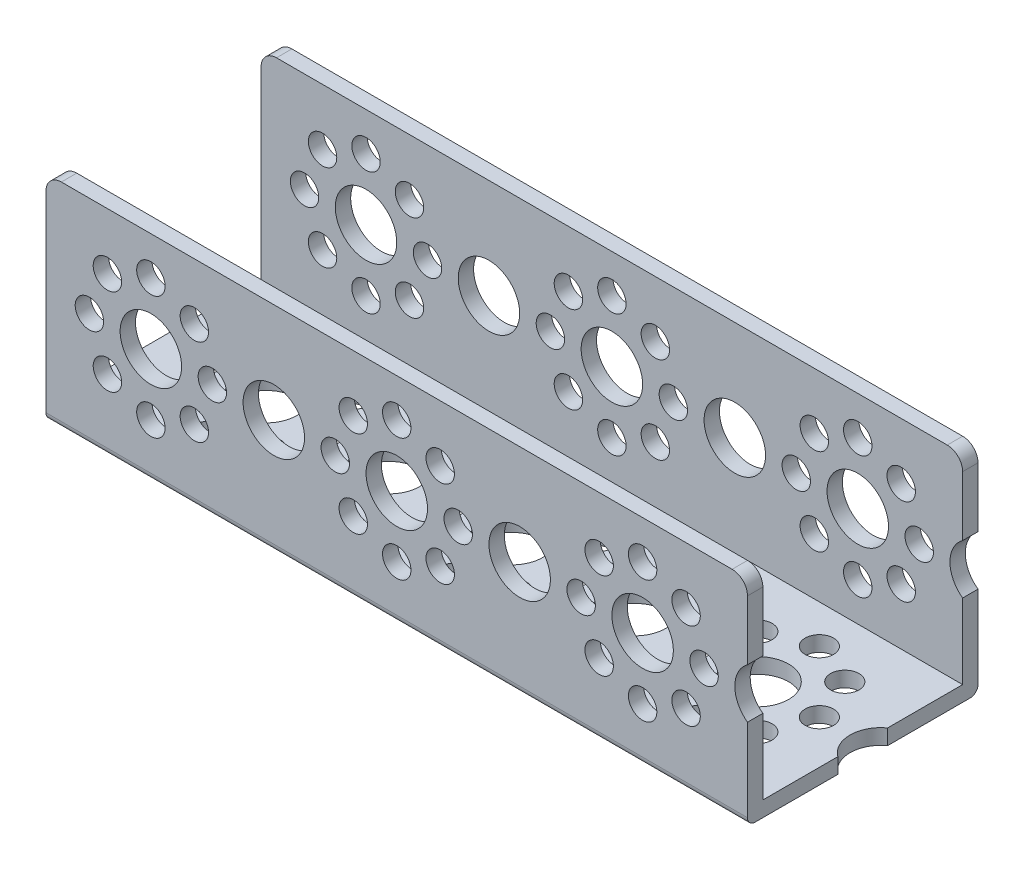
from build123d import *

# Parameters (mm, degrees)
EXTRUDE_2_DEPTH           = 91.3
HOLES_UP_R                = 4
HOLES_UP_R_2              = 1.85
CUT_EXTRUDE_1_DEPTH       = 15
CUT_EXTRUDE_START         = -15
CUT_EXTRUDE_2_OUTLINE_R   = 4
CUT_EXTRUDE_2_OUTLINE_R_2 = 1.85
CUT_EXTRUDE_2_DEPTH       = 30
FILLET_1_R                = 1
FILLET_2_R                = 2


with BuildPart() as part:
    # C Channel → 凸台-拉伸2 (new body)
    with BuildSketch(Plane.ZY.offset(13.65)):
        Polygon((-13, 13), (-15, 13), (-15, -15), (15, -15), (15, 13), (13, 13), (13, -13), (-13, -13), align=None)
    extrude(amount=-EXTRUDE_2_DEPTH)

    # holes up → 切除-拉伸1 (cut)
    with BuildSketch(Plane(origin=(0, 0, 0), x_dir=(1, 0, 0), z_dir=(0, 1, 0))):
        with Locations(Location((16, 0, 0), (0, 0, 270))):
            Circle(HOLES_UP_R)
        with Locations(Location((48, 0, 0), (0, 0, 270))):
            Circle(HOLES_UP_R)
        with Locations((80, 0)):
            Circle(HOLES_UP_R)
        with Locations((112, 0)):
            Circle(HOLES_UP_R)
        with Locations((144, 0)):
            Circle(HOLES_UP_R)
        with Locations((176, 0)):
            Circle(HOLES_UP_R)
        with Locations((208, 0)):
            Circle(HOLES_UP_R)
        with Locations((240, 0)):
            Circle(HOLES_UP_R)
        with Locations((272, 0)):
            Circle(HOLES_UP_R)
        with Locations((304, 0)):
            Circle(HOLES_UP_R)
        with Locations((336, 0)):
            Circle(HOLES_UP_R)
        with Locations((368, 0)):
            Circle(HOLES_UP_R)
        with Locations((400, 0)):
            Circle(HOLES_UP_R)
        with Locations((432, 0)):
            Circle(HOLES_UP_R)
        with Locations((464, 0)):
            Circle(HOLES_UP_R)
        with Locations((496, 0)):
            Circle(HOLES_UP_R)
        with Locations((528, 0)):
            Circle(HOLES_UP_R)
        with Locations((560, 0)):
            Circle(HOLES_UP_R)
        with Locations((592, 0)):
            Circle(HOLES_UP_R)
        with Locations((624, 0)):
            Circle(HOLES_UP_R)
        with Locations(Location((0, 0, 0), (0, 0, 270))):
            Circle(HOLES_UP_R)
        with Locations(Location((0, 8, 0), (0, 0, 270))):
            Circle(HOLES_UP_R_2)
        with Locations(Location((5.656854249, 5.656854249, 0), (0, 0, 270))):
            Circle(HOLES_UP_R_2)
        with Locations(Location((8, 0, 0), (0, 0, 270))):
            Circle(HOLES_UP_R_2)
        with Locations(Location((5.656854249, -5.656854249, 0), (0, 0, 270))):
            Circle(HOLES_UP_R_2)
        with Locations(Location((0, -8, 0), (0, 0, 270))):
            Circle(HOLES_UP_R_2)
        with Locations(Location((-5.656854249, -5.656854249, 0), (0, 0, 270))):
            Circle(HOLES_UP_R_2)
        with Locations(Location((-8, 0, 0), (0, 0, 270))):
            Circle(HOLES_UP_R_2)
        with Locations(Location((-5.656854249, 5.656854249, 0), (0, 0, 270))):
            Circle(HOLES_UP_R_2)
        with Locations(Location((32, 0, 0), (0, 0, 270))):
            Circle(HOLES_UP_R)
        with Locations(Location((32, 8, 0), (0, 0, 270))):
            Circle(HOLES_UP_R_2)
        with Locations(Location((37.656854249, 5.656854249, 0), (0, 0, 270))):
            Circle(HOLES_UP_R_2)
        with Locations(Location((40, 0, 0), (0, 0, 270))):
            Circle(HOLES_UP_R_2)
        with Locations(Location((37.656854249, -5.656854249, 0), (0, 0, 270))):
            Circle(HOLES_UP_R_2)
        with Locations(Location((32, -8, 0), (0, 0, 270))):
            Circle(HOLES_UP_R_2)
        with Locations(Location((26.343145751, -5.656854249, 0), (0, 0, 270))):
            Circle(HOLES_UP_R_2)
        with Locations(Location((24, 0, 0), (0, 0, 270))):
            Circle(HOLES_UP_R_2)
        with Locations(Location((26.343145751, 5.656854249, 0), (0, 0, 270))):
            Circle(HOLES_UP_R_2)
        with Locations(Location((64, 0, 0), (0, 0, 270))):
            Circle(HOLES_UP_R)
        with Locations(Location((64, 8, 0), (0, 0, 270))):
            Circle(HOLES_UP_R_2)
        with Locations(Location((69.656854249, 5.656854249, 0), (0, 0, 270))):
            Circle(HOLES_UP_R_2)
        with Locations(Location((72, 0, 0), (0, 0, 270))):
            Circle(HOLES_UP_R_2)
        with Locations(Location((69.656854249, -5.656854249, 0), (0, 0, 270))):
            Circle(HOLES_UP_R_2)
        with Locations(Location((64, -8, 0), (0, 0, 270))):
            Circle(HOLES_UP_R_2)
        with Locations(Location((58.343145751, -5.656854249, 0), (0, 0, 270))):
            Circle(HOLES_UP_R_2)
        with Locations(Location((56, 0, 0), (0, 0, 270))):
            Circle(HOLES_UP_R_2)
        with Locations(Location((58.343145751, 5.656854249, 0), (0, 0, 270))):
            Circle(HOLES_UP_R_2)
        with Locations((96, 0)):
            Circle(HOLES_UP_R)
        with Locations((96, 8)):
            Circle(HOLES_UP_R_2)
        with Locations((101.656854249, 5.656854249)):
            Circle(HOLES_UP_R_2)
        with Locations((104, 0)):
            Circle(HOLES_UP_R_2)
        with Locations((101.656854249, -5.656854249)):
            Circle(HOLES_UP_R_2)
        with Locations((96, -8)):
            Circle(HOLES_UP_R_2)
        with Locations((90.343145751, -5.656854249)):
            Circle(HOLES_UP_R_2)
        with Locations((88, 0)):
            Circle(HOLES_UP_R_2)
        with Locations((90.343145751, 5.656854249)):
            Circle(HOLES_UP_R_2)
        with Locations((128, 0)):
            Circle(HOLES_UP_R)
        with Locations((128, 8)):
            Circle(HOLES_UP_R_2)
        with Locations((133.656854249, 5.656854249)):
            Circle(HOLES_UP_R_2)
        with Locations((136, 0)):
            Circle(HOLES_UP_R_2)
        with Locations((133.656854249, -5.656854249)):
            Circle(HOLES_UP_R_2)
        with Locations((128, -8)):
            Circle(HOLES_UP_R_2)
        with Locations((122.343145751, -5.656854249)):
            Circle(HOLES_UP_R_2)
        with Locations((120, 0)):
            Circle(HOLES_UP_R_2)
        with Locations((122.343145751, 5.656854249)):
            Circle(HOLES_UP_R_2)
        with Locations((160, 0)):
            Circle(HOLES_UP_R)
        with Locations((160, 8)):
            Circle(HOLES_UP_R_2)
        with Locations((165.656854249, 5.656854249)):
            Circle(HOLES_UP_R_2)
        with Locations((168, 0)):
            Circle(HOLES_UP_R_2)
        with Locations((165.656854249, -5.656854249)):
            Circle(HOLES_UP_R_2)
        with Locations((160, -8)):
            Circle(HOLES_UP_R_2)
        with Locations((154.343145751, -5.656854249)):
            Circle(HOLES_UP_R_2)
        with Locations((152, 0)):
            Circle(HOLES_UP_R_2)
        with Locations((154.343145751, 5.656854249)):
            Circle(HOLES_UP_R_2)
        with Locations((192, 0)):
            Circle(HOLES_UP_R)
        with Locations((192, 8)):
            Circle(HOLES_UP_R_2)
        with Locations((197.656854249, 5.656854249)):
            Circle(HOLES_UP_R_2)
        with Locations((200, 0)):
            Circle(HOLES_UP_R_2)
        with Locations((197.656854249, -5.656854249)):
            Circle(HOLES_UP_R_2)
        with Locations((192, -8)):
            Circle(HOLES_UP_R_2)
        with Locations((186.343145751, -5.656854249)):
            Circle(HOLES_UP_R_2)
        with Locations((184, 0)):
            Circle(HOLES_UP_R_2)
        with Locations((186.343145751, 5.656854249)):
            Circle(HOLES_UP_R_2)
        with Locations((224, 0)):
            Circle(HOLES_UP_R)
        with Locations((224, 8)):
            Circle(HOLES_UP_R_2)
        with Locations((229.656854249, 5.656854249)):
            Circle(HOLES_UP_R_2)
        with Locations((232, 0)):
            Circle(HOLES_UP_R_2)
        with Locations((229.656854249, -5.656854249)):
            Circle(HOLES_UP_R_2)
        with Locations((224, -8)):
            Circle(HOLES_UP_R_2)
        with Locations((218.343145751, -5.656854249)):
            Circle(HOLES_UP_R_2)
        with Locations((216, 0)):
            Circle(HOLES_UP_R_2)
        with Locations((218.343145751, 5.656854249)):
            Circle(HOLES_UP_R_2)
        with Locations((256, 0)):
            Circle(HOLES_UP_R)
        with Locations((256, 8)):
            Circle(HOLES_UP_R_2)
        with Locations((261.656854249, 5.656854249)):
            Circle(HOLES_UP_R_2)
        with Locations((264, 0)):
            Circle(HOLES_UP_R_2)
        with Locations((261.656854249, -5.656854249)):
            Circle(HOLES_UP_R_2)
        with Locations((256, -8)):
            Circle(HOLES_UP_R_2)
        with Locations((250.343145751, -5.656854249)):
            Circle(HOLES_UP_R_2)
        with Locations((248, 0)):
            Circle(HOLES_UP_R_2)
        with Locations((250.343145751, 5.656854249)):
            Circle(HOLES_UP_R_2)
        with Locations((288, 0)):
            Circle(HOLES_UP_R)
        with Locations((288, 8)):
            Circle(HOLES_UP_R_2)
        with Locations((293.656854249, 5.656854249)):
            Circle(HOLES_UP_R_2)
        with Locations((296, 0)):
            Circle(HOLES_UP_R_2)
        with Locations((293.656854249, -5.656854249)):
            Circle(HOLES_UP_R_2)
        with Locations((288, -8)):
            Circle(HOLES_UP_R_2)
        with Locations((282.343145751, -5.656854249)):
            Circle(HOLES_UP_R_2)
        with Locations((280, 0)):
            Circle(HOLES_UP_R_2)
        with Locations((282.343145751, 5.656854249)):
            Circle(HOLES_UP_R_2)
        with Locations((320, 0)):
            Circle(HOLES_UP_R)
        with Locations((320, 8)):
            Circle(HOLES_UP_R_2)
        with Locations((325.656854249, 5.656854249)):
            Circle(HOLES_UP_R_2)
        with Locations((328, 0)):
            Circle(HOLES_UP_R_2)
        with Locations((325.656854249, -5.656854249)):
            Circle(HOLES_UP_R_2)
        with Locations((320, -8)):
            Circle(HOLES_UP_R_2)
        with Locations((314.343145751, -5.656854249)):
            Circle(HOLES_UP_R_2)
        with Locations((312, 0)):
            Circle(HOLES_UP_R_2)
        with Locations((314.343145751, 5.656854249)):
            Circle(HOLES_UP_R_2)
        with Locations((352, 0)):
            Circle(HOLES_UP_R)
        with Locations((352, 8)):
            Circle(HOLES_UP_R_2)
        with Locations((357.656854249, 5.656854249)):
            Circle(HOLES_UP_R_2)
        with Locations((360, 0)):
            Circle(HOLES_UP_R_2)
        with Locations((357.656854249, -5.656854249)):
            Circle(HOLES_UP_R_2)
        with Locations((352, -8)):
            Circle(HOLES_UP_R_2)
        with Locations((346.343145751, -5.656854249)):
            Circle(HOLES_UP_R_2)
        with Locations((344, 0)):
            Circle(HOLES_UP_R_2)
        with Locations((346.343145751, 5.656854249)):
            Circle(HOLES_UP_R_2)
        with Locations((384, 0)):
            Circle(HOLES_UP_R)
        with Locations((384, 8)):
            Circle(HOLES_UP_R_2)
        with Locations((389.656854249, 5.656854249)):
            Circle(HOLES_UP_R_2)
        with Locations((392, 0)):
            Circle(HOLES_UP_R_2)
        with Locations((389.656854249, -5.656854249)):
            Circle(HOLES_UP_R_2)
        with Locations((384, -8)):
            Circle(HOLES_UP_R_2)
        with Locations((378.343145751, -5.656854249)):
            Circle(HOLES_UP_R_2)
        with Locations((376, 0)):
            Circle(HOLES_UP_R_2)
        with Locations((378.343145751, 5.656854249)):
            Circle(HOLES_UP_R_2)
        with Locations((416, 0)):
            Circle(HOLES_UP_R)
        with Locations((416, 8)):
            Circle(HOLES_UP_R_2)
        with Locations((421.656854249, 5.656854249)):
            Circle(HOLES_UP_R_2)
        with Locations((424, 0)):
            Circle(HOLES_UP_R_2)
        with Locations((421.656854249, -5.656854249)):
            Circle(HOLES_UP_R_2)
        with Locations((416, -8)):
            Circle(HOLES_UP_R_2)
        with Locations((410.343145751, -5.656854249)):
            Circle(HOLES_UP_R_2)
        with Locations((408, 0)):
            Circle(HOLES_UP_R_2)
        with Locations((410.343145751, 5.656854249)):
            Circle(HOLES_UP_R_2)
        with Locations((448, 0)):
            Circle(HOLES_UP_R)
        with Locations((448, 8)):
            Circle(HOLES_UP_R_2)
        with Locations((453.656854249, 5.656854249)):
            Circle(HOLES_UP_R_2)
        with Locations((456, 0)):
            Circle(HOLES_UP_R_2)
        with Locations((453.656854249, -5.656854249)):
            Circle(HOLES_UP_R_2)
        with Locations((448, -8)):
            Circle(HOLES_UP_R_2)
        with Locations((442.343145751, -5.656854249)):
            Circle(HOLES_UP_R_2)
        with Locations((440, 0)):
            Circle(HOLES_UP_R_2)
        with Locations((442.343145751, 5.656854249)):
            Circle(HOLES_UP_R_2)
        with Locations((480, 0)):
            Circle(HOLES_UP_R)
        with Locations((480, 8)):
            Circle(HOLES_UP_R_2)
        with Locations((485.656854249, 5.656854249)):
            Circle(HOLES_UP_R_2)
        with Locations((488, 0)):
            Circle(HOLES_UP_R_2)
        with Locations((485.656854249, -5.656854249)):
            Circle(HOLES_UP_R_2)
        with Locations((480, -8)):
            Circle(HOLES_UP_R_2)
        with Locations((474.343145751, -5.656854249)):
            Circle(HOLES_UP_R_2)
        with Locations((472, 0)):
            Circle(HOLES_UP_R_2)
        with Locations((474.343145751, 5.656854249)):
            Circle(HOLES_UP_R_2)
        with Locations((512, 0)):
            Circle(HOLES_UP_R)
        with Locations((512, 8)):
            Circle(HOLES_UP_R_2)
        with Locations((517.656854249, 5.656854249)):
            Circle(HOLES_UP_R_2)
        with Locations((520, 0)):
            Circle(HOLES_UP_R_2)
        with Locations((517.656854249, -5.656854249)):
            Circle(HOLES_UP_R_2)
        with Locations((512, -8)):
            Circle(HOLES_UP_R_2)
        with Locations((506.343145751, -5.656854249)):
            Circle(HOLES_UP_R_2)
        with Locations((504, 0)):
            Circle(HOLES_UP_R_2)
        with Locations((506.343145751, 5.656854249)):
            Circle(HOLES_UP_R_2)
        with Locations((544, 0)):
            Circle(HOLES_UP_R)
        with Locations((544, 8)):
            Circle(HOLES_UP_R_2)
        with Locations((549.656854249, 5.656854249)):
            Circle(HOLES_UP_R_2)
        with Locations((552, 0)):
            Circle(HOLES_UP_R_2)
        with Locations((549.656854249, -5.656854249)):
            Circle(HOLES_UP_R_2)
        with Locations((544, -8)):
            Circle(HOLES_UP_R_2)
        with Locations((538.343145751, -5.656854249)):
            Circle(HOLES_UP_R_2)
        with Locations((536, 0)):
            Circle(HOLES_UP_R_2)
        with Locations((538.343145751, 5.656854249)):
            Circle(HOLES_UP_R_2)
        with Locations((576, 0)):
            Circle(HOLES_UP_R)
        with Locations((576, 8)):
            Circle(HOLES_UP_R_2)
        with Locations((581.656854249, 5.656854249)):
            Circle(HOLES_UP_R_2)
        with Locations((584, 0)):
            Circle(HOLES_UP_R_2)
        with Locations((581.656854249, -5.656854249)):
            Circle(HOLES_UP_R_2)
        with Locations((576, -8)):
            Circle(HOLES_UP_R_2)
        with Locations((570.343145751, -5.656854249)):
            Circle(HOLES_UP_R_2)
        with Locations((568, 0)):
            Circle(HOLES_UP_R_2)
        with Locations((570.343145751, 5.656854249)):
            Circle(HOLES_UP_R_2)
        with Locations((608, 0)):
            Circle(HOLES_UP_R)
        with Locations((608, 8)):
            Circle(HOLES_UP_R_2)
        with Locations((613.656854249, 5.656854249)):
            Circle(HOLES_UP_R_2)
        with Locations((616, 0)):
            Circle(HOLES_UP_R_2)
        with Locations((613.656854249, -5.656854249)):
            Circle(HOLES_UP_R_2)
        with Locations((608, -8)):
            Circle(HOLES_UP_R_2)
        with Locations((602.343145751, -5.656854249)):
            Circle(HOLES_UP_R_2)
        with Locations((600, 0)):
            Circle(HOLES_UP_R_2)
        with Locations((602.343145751, 5.656854249)):
            Circle(HOLES_UP_R_2)
    extrude(amount=-CUT_EXTRUDE_1_DEPTH, mode=Mode.SUBTRACT)

    # 切除-拉伸2: read off the stored shape, not the designer's step
    # 切除-拉伸2 outline → 切除-拉伸2 (cut)
    with BuildSketch(Plane.XY.offset(CUT_EXTRUDE_START)):
        with Locations((16, 0)):
            Circle(CUT_EXTRUDE_2_OUTLINE_R)
        with Locations((48, 0)):
            Circle(CUT_EXTRUDE_2_OUTLINE_R)
        with BuildLine():
            Line((77.65, -3.236896662), (77.65, 3.236896662))
            ThreePointArc((77.65, 3.236896662), (76, 0), (77.65, -3.236896662))
        make_face()
        Circle(CUT_EXTRUDE_2_OUTLINE_R)
        with Locations((8, 0)):
            Circle(CUT_EXTRUDE_2_OUTLINE_R_2)
        with Locations((5.656854249, -5.656854249)):
            Circle(CUT_EXTRUDE_2_OUTLINE_R_2)
        with Locations((0, -8)):
            Circle(CUT_EXTRUDE_2_OUTLINE_R_2)
        with Locations((-5.656854249, -5.656854249)):
            Circle(CUT_EXTRUDE_2_OUTLINE_R_2)
        with Locations((-8, 0)):
            Circle(CUT_EXTRUDE_2_OUTLINE_R_2)
        with Locations((-5.656854249, 5.656854249)):
            Circle(CUT_EXTRUDE_2_OUTLINE_R_2)
        with Locations((0, 8)):
            Circle(CUT_EXTRUDE_2_OUTLINE_R_2)
        with Locations((5.656854249, 5.656854249)):
            Circle(CUT_EXTRUDE_2_OUTLINE_R_2)
        with Locations((32, 0)):
            Circle(CUT_EXTRUDE_2_OUTLINE_R)
        with Locations((40, 0)):
            Circle(CUT_EXTRUDE_2_OUTLINE_R_2)
        with Locations((37.656854249, -5.656854249)):
            Circle(CUT_EXTRUDE_2_OUTLINE_R_2)
        with Locations((32, -8)):
            Circle(CUT_EXTRUDE_2_OUTLINE_R_2)
        with Locations((26.343145751, -5.656854249)):
            Circle(CUT_EXTRUDE_2_OUTLINE_R_2)
        with Locations((24, 0)):
            Circle(CUT_EXTRUDE_2_OUTLINE_R_2)
        with Locations((26.343145751, 5.656854249)):
            Circle(CUT_EXTRUDE_2_OUTLINE_R_2)
        with Locations((32, 8)):
            Circle(CUT_EXTRUDE_2_OUTLINE_R_2)
        with Locations((37.656854249, 5.656854249)):
            Circle(CUT_EXTRUDE_2_OUTLINE_R_2)
        with Locations((64, 0)):
            Circle(CUT_EXTRUDE_2_OUTLINE_R)
        with Locations((72, 0)):
            Circle(CUT_EXTRUDE_2_OUTLINE_R_2)
        with Locations((69.656854249, -5.656854249)):
            Circle(CUT_EXTRUDE_2_OUTLINE_R_2)
        with Locations((64, -8)):
            Circle(CUT_EXTRUDE_2_OUTLINE_R_2)
        with Locations((58.343145751, -5.656854249)):
            Circle(CUT_EXTRUDE_2_OUTLINE_R_2)
        with Locations((56, 0)):
            Circle(CUT_EXTRUDE_2_OUTLINE_R_2)
        with Locations((58.343145751, 5.656854249)):
            Circle(CUT_EXTRUDE_2_OUTLINE_R_2)
        with Locations((64, 8)):
            Circle(CUT_EXTRUDE_2_OUTLINE_R_2)
        with Locations((69.656854249, 5.656854249)):
            Circle(CUT_EXTRUDE_2_OUTLINE_R_2)
    extrude(amount=CUT_EXTRUDE_2_DEPTH, mode=Mode.SUBTRACT)

    # 圆角1
    fillet_1_edges = [part.edges().sort_by_distance(p)[0] for p in [
        (32, -15, 15),
        (32, -15, -15),
    ]]
    fillet(fillet_1_edges, radius=FILLET_1_R)

    # 圆角2
    fillet_2_edges = [part.edges().sort_by_distance(p)[0] for p in [
        (77.65, 13, -14),
        (77.65, 13, 14),
        (-13.65, 13, 14),
        (-13.65, 13, -14),
    ]]
    fillet(fillet_2_edges, radius=FILLET_2_R)


solid = part.part
